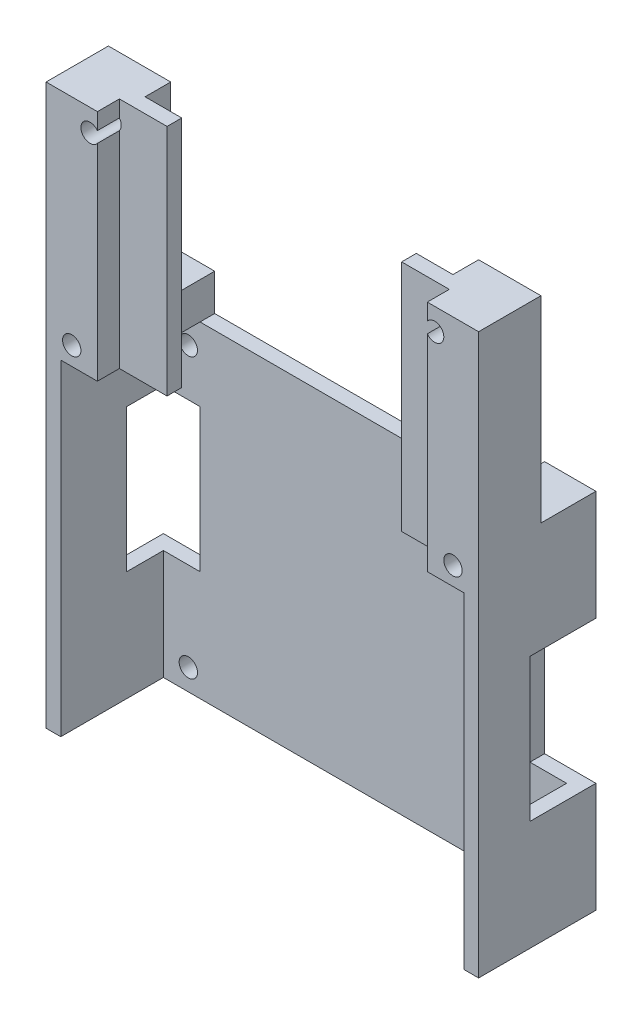
from build123d import *

# Parameters (mm, degrees)
BOSS_EXTRUDE1_DEPTH     = 44.5
SKETCH4_W               = 7
SKETCH4_H               = 9
BOSS_EXTRUDE3_DEPTH     = 5
SKETCH5_R               = 1.25
CUT_EXTRUDE3_DEPTH      = 78.538700015
BOSS_EXTRUDE4_DEPTH     = 3
SKETCH10_W              = 7
SKETCH10_H              = 19.5
CUT_EXTRUDE6_DEPTH      = 7
CHAMFER3_SIZE           = 2
CUT_EXTRUDE5_DEPTH      = 78.538700015
CUT_EXTRUDE5_DEPTH_BACK = 78.538700015
SKETCH9_W               = 59
SKETCH9_H               = 2
CUT_EXTRUDE7_DEPTH      = 0.5
SKETCH12_W              = 7
SKETCH12_H              = 2
SKETCH12_W_2            = 1.5
SKETCH12_H_2            = 3.5
SKETCH12_H_3            = 3
BOSS_EXTRUDE5_DEPTH     = 26.85
CUT_EXTRUDE4_START      = -16
CUT_EXTRUDE4_OUTLINE_R  = 1.25
CUT_EXTRUDE4_DEPTH      = 16
SKETCH12_4_W            = 1.5
SKETCH12_4_H            = 3.5
BOSS_EXTRUDE6_DEPTH     = 5


# Read off the part's stored shape, not the designer's step: Cut-Extrude4
with BuildPart() as part:
    # Sketch1 → Boss-Extrude1 (new body)
    with BuildSketch(Plane(origin=(0, 0, 0), x_dir=(1, 0, 0), z_dir=(0, 1, 0))):
        Polygon((0, 0), (2, 0), (2, 7), (57, 7), (57, 0), (59, 0), (59, 9), (0, 9), align=None)
    extrude(amount=BOSS_EXTRUDE1_DEPTH)

    # Sketch4 → Boss-Extrude3 (add)
    with BuildSketch(Plane(origin=(0, 44.5, 0), x_dir=(1, 0, 0), z_dir=(0, 1, 0))):
        with Locations((3.5, 4.5)):
            Rectangle(SKETCH4_W, SKETCH4_H)
        with Locations((55.5, 4.5)):
            Rectangle(SKETCH4_W, SKETCH4_H)
    extrude(amount=BOSS_EXTRUDE3_DEPTH)

    # Sketch5 → Cut-Extrude3 (cut, through all)
    with BuildSketch(Plane(origin=(0, 0, -9), x_dir=(-1, 0, 0), z_dir=(0, 0, -1))):
        with Locations((-55.5, 47)):
            Circle(SKETCH5_R)
        with Locations((-3.5, 47)):
            Circle(SKETCH5_R)
    extrude(amount=-CUT_EXTRUDE3_DEPTH, mode=Mode.SUBTRACT)

    # Sketch3 → Boss-Extrude4 (add)
    with BuildSketch(Plane(origin=(0, 0, -9), x_dir=(-1, 0, 0), z_dir=(0, 0, -1))):
        with BuildLine():
            ThreePointArc((1.75, 5), (1.184653197, 6.045825033), (0, 6.145643924))
            Line((0, 6.145643924), (0, 3.854356076))
            ThreePointArc((0, 3.854356076), (1.184653197, 3.954174967), (1.75, 5))
        make_face()
        with BuildLine():
            Line((-59, 3.854356076), (-59, 6.145643924))
            ThreePointArc((-59, 6.145643924), (-60.75, 5), (-59, 3.854356076))
        make_face()
    extrude(amount=BOSS_EXTRUDE4_DEPTH)


with BuildPart() as boss_extrude4_kept_piece:
    # of the separate pieces the step leaves, the one the design keeps (boss_extrude4_pieces_kept)
    add(part.part.solids().sort_by_distance((0, 49.5, 0))[0])

    # Mirror2: Boss-Extrude4 kept piece across plane


with BuildPart() as boss_extrude4_kept_piece_1:
    add(boss_extrude4_kept_piece.part)
    add(boss_extrude4_kept_piece.part.mirror(Plane.XY))

    # Sketch10 → Cut-Extrude6 (cut)
    with BuildSketch(Plane(origin=(0, 0, -9), x_dir=(-1, 0, 0), z_dir=(0, 0, -1))):
        with Locations((-55.5, 24.75)):
            Rectangle(SKETCH10_W, SKETCH10_H)
        with Locations((-3.5, 24.75)):
            Rectangle(SKETCH10_W, SKETCH10_H)
    extrude(amount=-CUT_EXTRUDE6_DEPTH, mode=Mode.SUBTRACT)

    # Chamfer3
    chamfer3_edges = [boss_extrude4_kept_piece_1.edges().sort_by_distance(p)[0] for p in [
        (0, 24.75, -2),
        (59, 24.75, -2),
    ]]
    chamfer(chamfer3_edges, length=CHAMFER3_SIZE - 0.0001)  # a hair under: the kernel refuses the full size

    # Sketch9 → Cut-Extrude5 (cut, two sides: drawn at the far end of the back side and taken through both)
    with BuildSketch(Plane.XZ.offset(-CUT_EXTRUDE5_DEPTH_BACK)):
        with Locations((29.5, 8)):
            Rectangle(SKETCH9_W, SKETCH9_H)
    extrude(amount=CUT_EXTRUDE5_DEPTH + CUT_EXTRUDE5_DEPTH_BACK, mode=Mode.SUBTRACT)

    # Sketch11 → Cut-Extrude7 (cut)
    with BuildSketch(Plane(origin=(0, 0, -9), x_dir=(-1, 0, 0), z_dir=(0, 0, -1))):
        Polygon((-32.1435681, 39.366852384), (-24.568842978, 39.366852384), (-28.293120049, 29.306670581), (-20.718394926, 29.306670581), (-37.51393239, 7.144924052), (-33.031231201, 22.264543319), (-40.605956323, 22.264543319), align=None)
    extrude(amount=-CUT_EXTRUDE7_DEPTH, mode=Mode.SUBTRACT)

    # Sketch12 → Boss-Extrude5 (add)
    with BuildSketch(Plane(origin=(0, 49.5, 0), x_dir=(1, 0, 0), z_dir=(0, 1, 0))):
        with Locations((55.5, -3)):
            Rectangle(SKETCH12_W, SKETCH12_H)
        Polygon((7, -2), (7, -4), (13.5, -4), (13.5, -2), (8.5, -2), align=None)
        Polygon((45.5, -2), (45.5, -4), (52, -4), (52, -2), (50.5, -2), align=None)
        with Locations((7.75, -0.25)):
            Rectangle(SKETCH12_W_2, SKETCH12_H_2)
        with Locations((3.5, -0.25)):
            Rectangle(SKETCH12_W, SKETCH12_H_2)
        with Locations((51.25, -0.25)):
            Rectangle(SKETCH12_W_2, SKETCH12_H_2)
        with Locations((55.5, -0.25)):
            Rectangle(SKETCH12_W, SKETCH12_H_2)
        with Locations((3.5, -3)):
            Rectangle(SKETCH12_W, SKETCH12_H)
        with Locations((3.5, -5.5)):
            Rectangle(SKETCH12_W, SKETCH12_H_3)
        with Locations((55.5, -5.5)):
            Rectangle(SKETCH12_W, SKETCH12_H_3)
    extrude(amount=BOSS_EXTRUDE5_DEPTH)

    # Cut-Extrude4 outline → Cut-Extrude4 (cut)
    with BuildSketch(Plane(origin=(0, 0, -9), x_dir=(-1, 0, 0), z_dir=(0, 0, -1)).offset(CUT_EXTRUDE4_START)):
        with Locations((-53, 73.35)):
            Circle(CUT_EXTRUDE4_OUTLINE_R)
        with Locations((-6, 73.35)):
            Circle(CUT_EXTRUDE4_OUTLINE_R)
        with Locations((-53.6, 40.95)):
            Circle(CUT_EXTRUDE4_OUTLINE_R)
        with Locations((-5.4, 40.95)):
            Circle(CUT_EXTRUDE4_OUTLINE_R)
        with Locations((-5.4, 2.9)):
            Circle(CUT_EXTRUDE4_OUTLINE_R)
        with Locations((-53.6, 2.9)):
            Circle(CUT_EXTRUDE4_OUTLINE_R)
    extrude(amount=CUT_EXTRUDE4_DEPTH, mode=Mode.SUBTRACT)

    # Sketch12<4> → Boss-Extrude6 (add)
    with BuildSketch(Plane(origin=(0, 49.5, 0), x_dir=(1, 0, 0), z_dir=(0, 1, 0))):
        Polygon((7, -2), (7, -4), (13.5, -4), (13.5, -2), (8.5, -2), align=None)
        Polygon((45.5, -2), (45.5, -4), (52, -4), (52, -2), (50.5, -2), align=None)
        with Locations((7.75, -0.25)):
            Rectangle(SKETCH12_4_W, SKETCH12_4_H)
        with Locations((51.25, -0.25)):
            Rectangle(SKETCH12_4_W, SKETCH12_4_H)
    extrude(amount=-BOSS_EXTRUDE6_DEPTH)


solid = boss_extrude4_kept_piece_1.part
